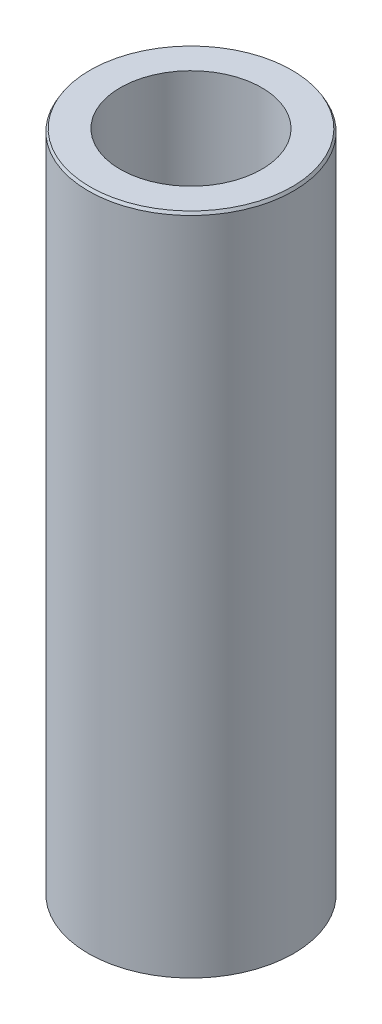
from build123d import *
from OCP.BRepFilletAPI import BRepFilletAPI_MakeChamfer

# Parameters (mm, degrees)
SKETCH1_R           = 40
BOSS_EXTRUDE1_DEPTH = 259.075646591
SKETCH2_R           = 27.580915956
CUT_EXTRUDE1_DEPTH  = 266.179544189
CHAMFER1_SIZE       = 1.091479625
CHAMFER1_SIZE2      = 0.630166055


with BuildPart() as part:
    # Sketch1 → Boss-Extrude1 (new body)
    with BuildSketch(Plane(origin=(0, 0, 0), x_dir=(1, 0, 0), z_dir=(0, 1, 0))):
        Circle(SKETCH1_R)
    extrude(amount=BOSS_EXTRUDE1_DEPTH)

    # Sketch2 → Cut-Extrude1 (cut, through all)
    with BuildSketch(Plane(origin=(0, 0, 0), x_dir=(1, 0, 0), z_dir=(0, 1, 0))):
        Circle(SKETCH2_R)
    extrude(amount=CUT_EXTRUDE1_DEPTH, mode=Mode.SUBTRACT)

    # Chamfer1: one chamfer whose edges measure the first distance from different faces: ONE call of the kernel's chamfer builder (chamfer() names one face for all edges)
    chamfer1_edges_1 = [part.edges().sort_by_distance(p)[0] for p in [
        (-40, 259.075646591, 0),
    ]]
    chamfer1_side_1 = [part.faces().sort_by_distance(p)[0] for p in [
        (-40, 129.537823295, 0),
    ]]
    chamfer1_edges_2 = [part.edges().sort_by_distance(p)[0] for p in [
        (-40, 0, 0),
    ]]
    chamfer1_side_2 = [part.faces().sort_by_distance(p)[0] for p in [
        (-38.86862915, 0, 0),
    ]]
    chamfer1 = BRepFilletAPI_MakeChamfer(part.part.solid().wrapped)
    for e in chamfer1_edges_1:
        chamfer1.Add(CHAMFER1_SIZE, CHAMFER1_SIZE2, e.wrapped, chamfer1_side_1[0].wrapped)  # the first distance lies on this face
    for e in chamfer1_edges_2:
        chamfer1.Add(CHAMFER1_SIZE, CHAMFER1_SIZE2, e.wrapped, chamfer1_side_2[0].wrapped)  # the first distance lies on this face
    add(Compound.cast(chamfer1.Shape()), mode=Mode.REPLACE)


solid = part.part
